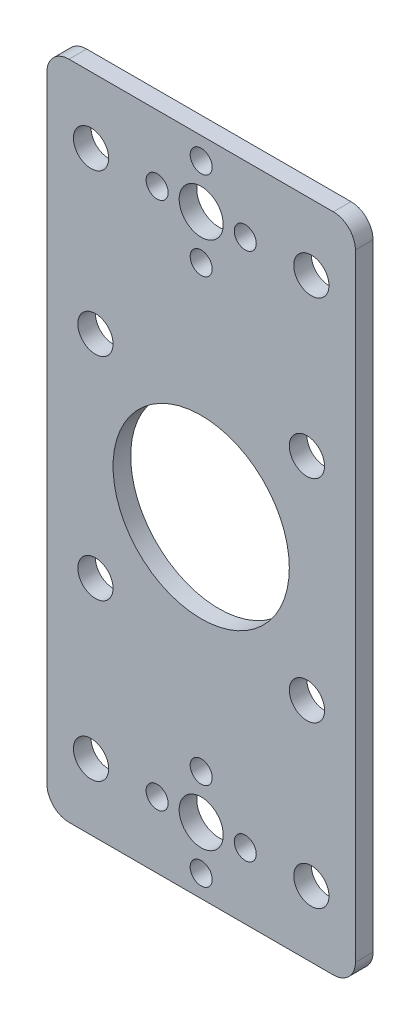
from build123d import *

# Parameters (mm, degrees)
SKETCH1_W               = 70
SKETCH1_H               = 150
SKETCH1_R               = 20
SKETCH1_R_2             = 4
BASE_FLANGE1_DEPTH      = 4
FILLET1_R               = 5
CUT_EXTRUDE1_DEPTH      = 84.903688401
CUT_EXTRUDE1_DEPTH_BACK = 4
SKETCH2_R               = 5
SKETCH3_R               = 2.5
CUT_EXTRUDE2_DEPTH      = 4


# Sheet-metal steps are written as plain solids
with BuildPart() as part:
    # Sketch1 → Base-Flange1 (new body)
    with BuildSketch(Plane.XY):
        with Locations((1.028252341, 0.668976209)):
            Rectangle(SKETCH1_W, SKETCH1_H)
        with Locations((1.028252341, 0.668976209)):
            Circle(SKETCH1_R, mode=Mode.SUBTRACT)
        with Locations((-22.971747659, 24.668976209)):
            Circle(SKETCH1_R_2, mode=Mode.SUBTRACT)
        with Locations((25.028252341, 24.668976209)):
            Circle(SKETCH1_R_2, mode=Mode.SUBTRACT)
        with Locations((25.028252341, -23.331023791)):
            Circle(SKETCH1_R_2, mode=Mode.SUBTRACT)
        with Locations((-22.971747659, -23.331023791)):
            Circle(SKETCH1_R_2, mode=Mode.SUBTRACT)
        with Locations((26.028252341, 60.668976209)):
            Circle(SKETCH1_R_2, mode=Mode.SUBTRACT)
        with Locations((-23.971747659, 60.668976209)):
            Circle(SKETCH1_R_2, mode=Mode.SUBTRACT)
        with Locations((26.028252341, -59.331023791)):
            Circle(SKETCH1_R_2, mode=Mode.SUBTRACT)
        with Locations((-23.971747659, -59.331023791)):
            Circle(SKETCH1_R_2, mode=Mode.SUBTRACT)
    extrude(amount=-BASE_FLANGE1_DEPTH)

    # Fillet1
    fillet1_edges = [part.edges().sort_by_distance(p)[0] for p in [
        (-33.971747659, 75.668976209, -2),
        (36.028252341, 75.668976209, -2),
        (36.028252341, -74.331023791, -2),
        (-33.971747659, -74.331023791, -2),
    ]]
    fillet(fillet1_edges, radius=FILLET1_R)

    # Sketch2 → Cut-Extrude1 (cut, two sides: drawn at the far end of the back side and taken through both)
    with BuildSketch(Plane.XY.offset(-CUT_EXTRUDE1_DEPTH_BACK)):
        with Locations((1.028252341, 60.668976209)):
            Circle(SKETCH2_R)
        with Locations((1.028252341, -59.331023791)):
            Circle(SKETCH2_R)
    extrude(amount=CUT_EXTRUDE1_DEPTH + CUT_EXTRUDE1_DEPTH_BACK, mode=Mode.SUBTRACT)

    # Sketch3 → Cut-Extrude2 (cut)
    with BuildSketch(Plane.XY):
        with Locations((1.028252341, 70.668976209)):
            Circle(SKETCH3_R)
        with Locations((11.028252341, 60.668976209)):
            Circle(SKETCH3_R)
        with Locations((1.028252341, 50.668976209)):
            Circle(SKETCH3_R)
        with Locations((-8.971747659, 60.668976209)):
            Circle(SKETCH3_R)
        with Locations((-8.971747659, -59.331023791)):
            Circle(SKETCH3_R)
        with Locations((1.028252341, -49.331023791)):
            Circle(SKETCH3_R)
        with Locations((11.028252341, -59.331023791)):
            Circle(SKETCH3_R)
        with Locations((1.028252341, -69.331023791)):
            Circle(SKETCH3_R)
    extrude(amount=-CUT_EXTRUDE2_DEPTH, mode=Mode.SUBTRACT)


solid = part.part
